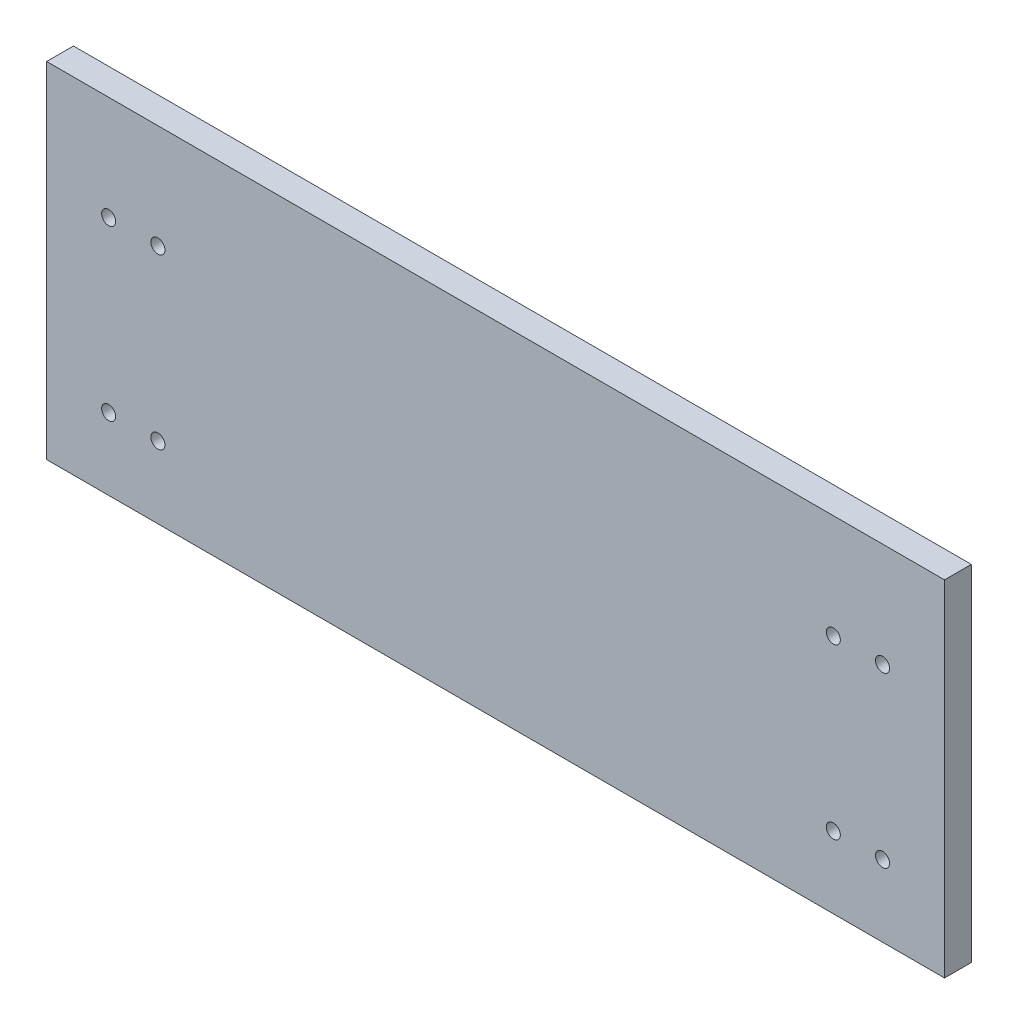
from build123d import *

# Parameters (mm, degrees)
SKETCH1_W                  = 638.1
SKETCH1_H                  = 245.05
BOSS_EXTRUDE1_DEPTH        = 19.05
F_10_0MM_DOWEL_HOLE1_D     = 10
F_10_0MM_DOWEL_HOLE1_DEPTH = 26.995696905
F_10_0MM_DOWEL_HOLE1_TIP   = 3.004303095


with BuildPart() as part:
    # Sketch1 → Boss-Extrude1 (new body)
    with BuildSketch(Plane.XY):
        with Locations((0, -103.475)):
            Rectangle(SKETCH1_W, SKETCH1_H)
    extrude(amount=BOSS_EXTRUDE1_DEPTH)

    # Ø10.0mm Dowel Hole1
    with Locations(Plane.XY.offset(19.05)):
        with Locations((275, -175), (275, -55), (240, -175), (240, -55), (-275, -175), (-240, -175), (-240, -55), (-275, -55)):
            Hole(F_10_0MM_DOWEL_HOLE1_D / 2, depth=F_10_0MM_DOWEL_HOLE1_DEPTH)
            with Locations((0, 0, -(F_10_0MM_DOWEL_HOLE1_DEPTH + F_10_0MM_DOWEL_HOLE1_TIP / 2))):  # 118° drill point
                Cone(0, F_10_0MM_DOWEL_HOLE1_D / 2, F_10_0MM_DOWEL_HOLE1_TIP, mode=Mode.SUBTRACT)


solid = part.part
